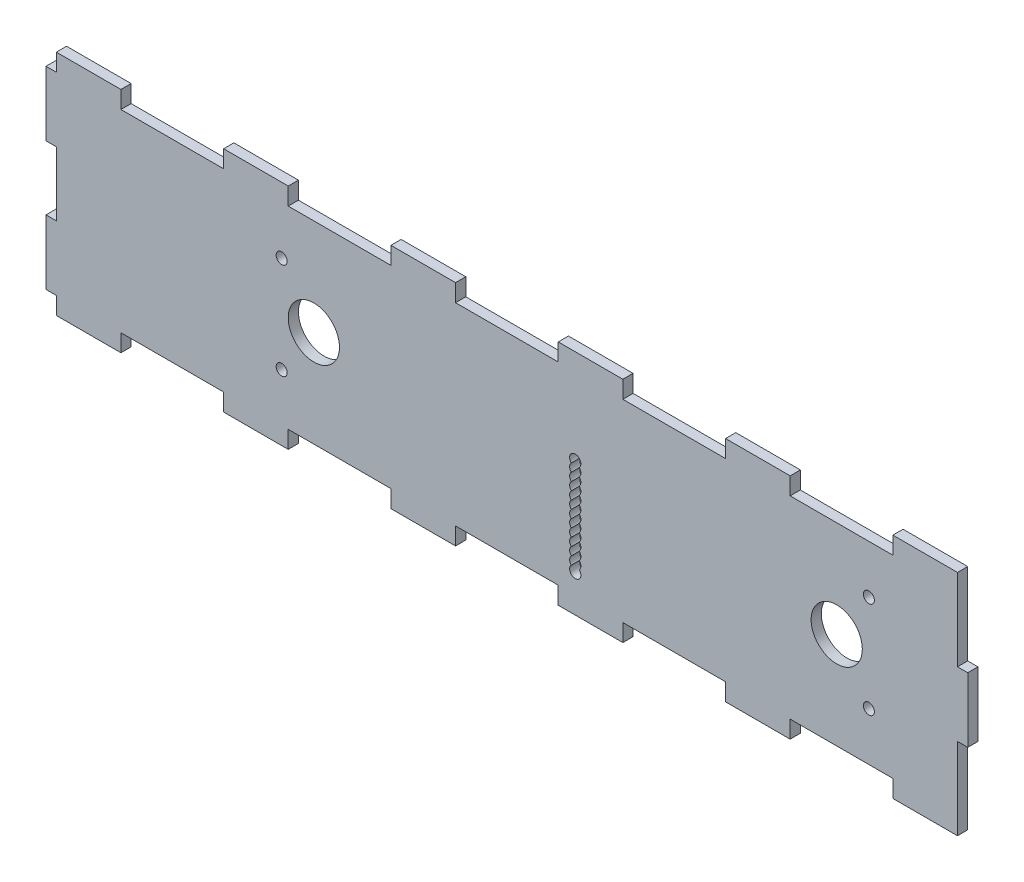
from build123d import *

# Parameters (mm, degrees)
BOSS_EXTRUDE1_OUTLINE_R   = 1.755
BOSS_EXTRUDE1_OUTLINE_R_2 = 8
BOSS_EXTRUDE1_DEPTH       = 3.175
BOSS_EXTRUDE2_START       = -3.175
SKETCH5_R                 = 7.95936
SKETCH5_R_2               = 1.71436
BOSS_EXTRUDE2_DEPTH       = 3.175


# Read off the part's stored shape, not the designer's step: Boss-Extrude1
with BuildPart() as part:
    # Boss-Extrude1 outline → Boss-Extrude1 (new body)
    with BuildSketch(Plane.XY):
        Polygon((-140, 10), (-140, -10), (-143.2, -10), (-143.2, -30), (-140, -30), (-140, -35.4), (-120, -35.4), (-120, -30), (-88, -30), (-88, -35.4), (-68, -35.4), (-68, -30), (-36, -30), (-36, -35.4), (-16, -35.4), (-16, -30), (16, -30), (16, -35.4), (36, -35.4), (36, -30), (68, -30), (68, -35.4), (88, -35.4), (88, -30), (120, -30), (120, -35.4), (140, -35.4), (140, -10), (143.2, -10), (143.2, 10), (140, 10), (140, 35.4), (120, 35.4), (120, 30), (88, 30), (88, 35.4), (68, 35.4), (68, 30), (36, 30), (36, 35.4), (16, 35.4), (16, 30), (-16, 30), (-16, 35.4), (-36, 35.4), (-36, 30), (-68, 30), (-68, 35.4), (-88, 35.4), (-88, 30), (-120, 30), (-120, 35.4), (-140, 35.4), (-140, 30), (-143.2, 30), (-143.2, 10), align=None)
        with Locations((-70, -15)):
            Circle(BOSS_EXTRUDE1_OUTLINE_R, mode=Mode.SUBTRACT)
        with BuildLine():
            ThreePointArc((22.474744871, -20.1), (23, -21.35), (22.474744871, -22.6))
            ThreePointArc((22.474744871, -22.6), (21.25, -25.6), (20.025255129, -22.6))
            ThreePointArc((20.025255129, -22.6), (19.5, -21.35), (20.025255129, -20.1))
            ThreePointArc((20.025255129, -20.1), (19.5, -18.85), (20.025255129, -17.6))
            ThreePointArc((20.025255129, -17.6), (19.5, -16.35), (20.025255129, -15.1))
            ThreePointArc((20.025255129, -15.1), (19.5, -13.85), (20.025255129, -12.6))
            ThreePointArc((20.025255129, -12.6), (19.5, -11.35), (20.025255129, -10.1))
            ThreePointArc((20.025255129, -10.1), (19.5, -8.85), (20.025255129, -7.6))
            ThreePointArc((20.025255129, -7.6), (19.5, -6.35), (20.025255129, -5.1))
            ThreePointArc((20.025255129, -5.1), (19.5, -3.85), (20.025255129, -2.6))
            ThreePointArc((20.025255129, -2.6), (19.5, -1.35), (20.025255129, -0.1))
            ThreePointArc((20.025255129, -0.1), (19.5, 1.15), (20.025255129, 2.4))
            ThreePointArc((20.025255129, 2.4), (19.5, 3.65), (20.025255129, 4.9))
            ThreePointArc((20.025255129, 4.9), (21.25, 7.9), (22.474744871, 4.9))
            ThreePointArc((22.474744871, 4.9), (23, 3.65), (22.474744871, 2.4))
            ThreePointArc((22.474744871, 2.4), (23, 1.15), (22.474744871, -0.1))
            ThreePointArc((22.474744871, -0.1), (23, -1.35), (22.474744871, -2.6))
            ThreePointArc((22.474744871, -2.6), (23, -3.85), (22.474744871, -5.1))
            ThreePointArc((22.474744871, -5.1), (23, -6.35), (22.474744871, -7.6))
            ThreePointArc((22.474744871, -7.6), (23, -8.85), (22.474744871, -10.1))
            ThreePointArc((22.474744871, -10.1), (23, -11.35), (22.474744871, -12.6))
            ThreePointArc((22.474744871, -12.6), (23, -13.85), (22.474744871, -15.1))
            ThreePointArc((22.474744871, -15.1), (23, -16.35), (22.474744871, -17.6))
            ThreePointArc((22.474744871, -17.6), (23, -18.85), (22.474744871, -20.1))
        make_face(mode=Mode.SUBTRACT)
        with Locations((112.5, -15)):
            Circle(BOSS_EXTRUDE1_OUTLINE_R, mode=Mode.SUBTRACT)
        with Locations((-60, 0)):
            Circle(BOSS_EXTRUDE1_OUTLINE_R_2, mode=Mode.SUBTRACT)
        with Locations((-70, 15)):
            Circle(BOSS_EXTRUDE1_OUTLINE_R, mode=Mode.SUBTRACT)
        with Locations((102.5, 0)):
            Circle(BOSS_EXTRUDE1_OUTLINE_R_2, mode=Mode.SUBTRACT)
        with Locations((112.5, 15)):
            Circle(BOSS_EXTRUDE1_OUTLINE_R, mode=Mode.SUBTRACT)
    extrude(amount=BOSS_EXTRUDE1_DEPTH)

    # Sketch5 → Boss-Extrude2 (add)
    with BuildSketch(Plane.XY.offset(3.175).offset(BOSS_EXTRUDE2_START)):
        Polygon((140.04064, 10.04064), (140.04064, 35.44064), (119.95936, 35.44064), (119.95936, 30.04064), (88.04064, 30.04064), (88.04064, 35.44064), (67.95936, 35.44064), (67.95936, 30.04064), (36.04064, 30.04064), (36.04064, 35.44064), (15.95936, 35.44064), (15.95936, 30.04064), (-15.95936, 30.04064), (-15.95936, 35.44064), (-36.04064, 35.44064), (-36.04064, 30.04064), (-67.95936, 30.04064), (-67.95936, 35.44064), (-88.04064, 35.44064), (-88.04064, 30.04064), (-119.95936, 30.04064), (-119.95936, 35.44064), (-140.04064, 35.44064), (-140.04064, 30.04064), (-143.24064, 30.04064), (-143.24064, 9.95936), (-140.04064, 9.95936), (-140.04064, -9.95936), (-143.24064, -9.95936), (-143.24064, -30.04064), (-140.04064, -30.04064), (-140.04064, -35.44064), (-119.95936, -35.44064), (-119.95936, -30.04064), (-88.04064, -30.04064), (-88.04064, -35.44064), (-67.95936, -35.44064), (-67.95936, -30.04064), (-36.04064, -30.04064), (-36.04064, -35.44064), (-15.95936, -35.44064), (-15.95936, -30.04064), (15.95936, -30.04064), (15.95936, -35.44064), (36.04064, -35.44064), (36.04064, -30.04064), (67.95936, -30.04064), (67.95936, -35.44064), (88.04064, -35.44064), (88.04064, -30.04064), (119.95936, -30.04064), (119.95936, -35.44064), (140.04064, -35.44064), (140.04064, -10.04064), (143.24064, -10.04064), (143.24064, 10.04064), align=None)
        with Locations((-60, 0)):
            Circle(SKETCH5_R, mode=Mode.SUBTRACT)
        with Locations((-70, 15)):
            Circle(SKETCH5_R_2, mode=Mode.SUBTRACT)
        with Locations((-70, -15)):
            Circle(SKETCH5_R_2, mode=Mode.SUBTRACT)
        with Locations((102.5, 0)):
            Circle(SKETCH5_R, mode=Mode.SUBTRACT)
        with Locations((112.5, 15)):
            Circle(SKETCH5_R_2, mode=Mode.SUBTRACT)
        with Locations((112.5, -15)):
            Circle(SKETCH5_R_2, mode=Mode.SUBTRACT)
        with BuildLine():
            ThreePointArc((22.474744871, 4.9), (21.25, 7.9), (20.025255129, 4.9))
            ThreePointArc((20.025255129, 4.9), (19.5, 3.65), (20.025255129, 2.4))
            ThreePointArc((20.025255129, 2.4), (19.5, 1.15), (20.025255129, -0.1))
            ThreePointArc((20.025255129, -0.1), (19.5, -1.35), (20.025255129, -2.6))
            ThreePointArc((20.025255129, -2.6), (19.5, -3.85), (20.025255129, -5.1))
            ThreePointArc((20.025255129, -5.1), (19.5, -6.35), (20.025255129, -7.6))
            ThreePointArc((20.025255129, -7.6), (19.5, -8.85), (20.025255129, -10.1))
            ThreePointArc((20.025255129, -10.1), (19.5, -11.35), (20.025255129, -12.6))
            ThreePointArc((20.025255129, -12.6), (19.5, -13.85), (20.025255129, -15.1))
            ThreePointArc((20.025255129, -15.1), (19.5, -16.35), (20.025255129, -17.6))
            ThreePointArc((20.025255129, -17.6), (19.5, -18.85), (20.025255129, -20.1))
            ThreePointArc((20.025255129, -20.1), (19.5, -21.35), (20.025255129, -22.6))
            ThreePointArc((20.025255129, -22.6), (21.25, -25.6), (22.474744871, -22.6))
            ThreePointArc((22.474744871, -22.6), (23, -21.35), (22.474744871, -20.1))
            ThreePointArc((22.474744871, -20.1), (23, -18.85), (22.474744871, -17.6))
            ThreePointArc((22.474744871, -17.6), (23, -16.35), (22.474744871, -15.1))
            ThreePointArc((22.474744871, -15.1), (23, -13.85), (22.474744871, -12.6))
            ThreePointArc((22.474744871, -12.6), (23, -11.35), (22.474744871, -10.1))
            ThreePointArc((22.474744871, -10.1), (23, -8.85), (22.474744871, -7.6))
            ThreePointArc((22.474744871, -7.6), (23, -6.35), (22.474744871, -5.1))
            ThreePointArc((22.474744871, -5.1), (23, -3.85), (22.474744871, -2.6))
            ThreePointArc((22.474744871, -2.6), (23, -1.35), (22.474744871, -0.1))
            ThreePointArc((22.474744871, -0.1), (23, 1.15), (22.474744871, 2.4))
            ThreePointArc((22.474744871, 2.4), (23, 3.65), (22.474744871, 4.9))
        make_face(mode=Mode.SUBTRACT)
    extrude(amount=BOSS_EXTRUDE2_DEPTH)


solid = part.part
